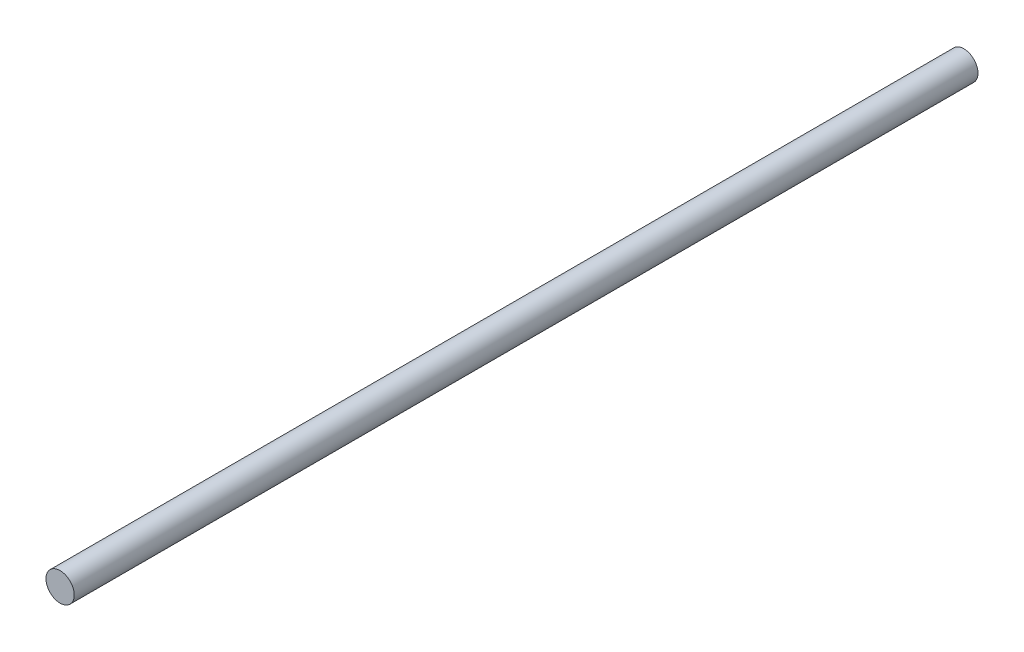
from build123d import *

# Parameters (mm, degrees)
SKETCH1_R           = 0.396875
BOSS_EXTRUDE1_DEPTH = 25.4


with BuildPart() as part:
    # Sketch1 → Boss-Extrude1 (new body)
    with BuildSketch(Plane.XY):
        Circle(SKETCH1_R)
    extrude(amount=BOSS_EXTRUDE1_DEPTH)


solid = part.part
